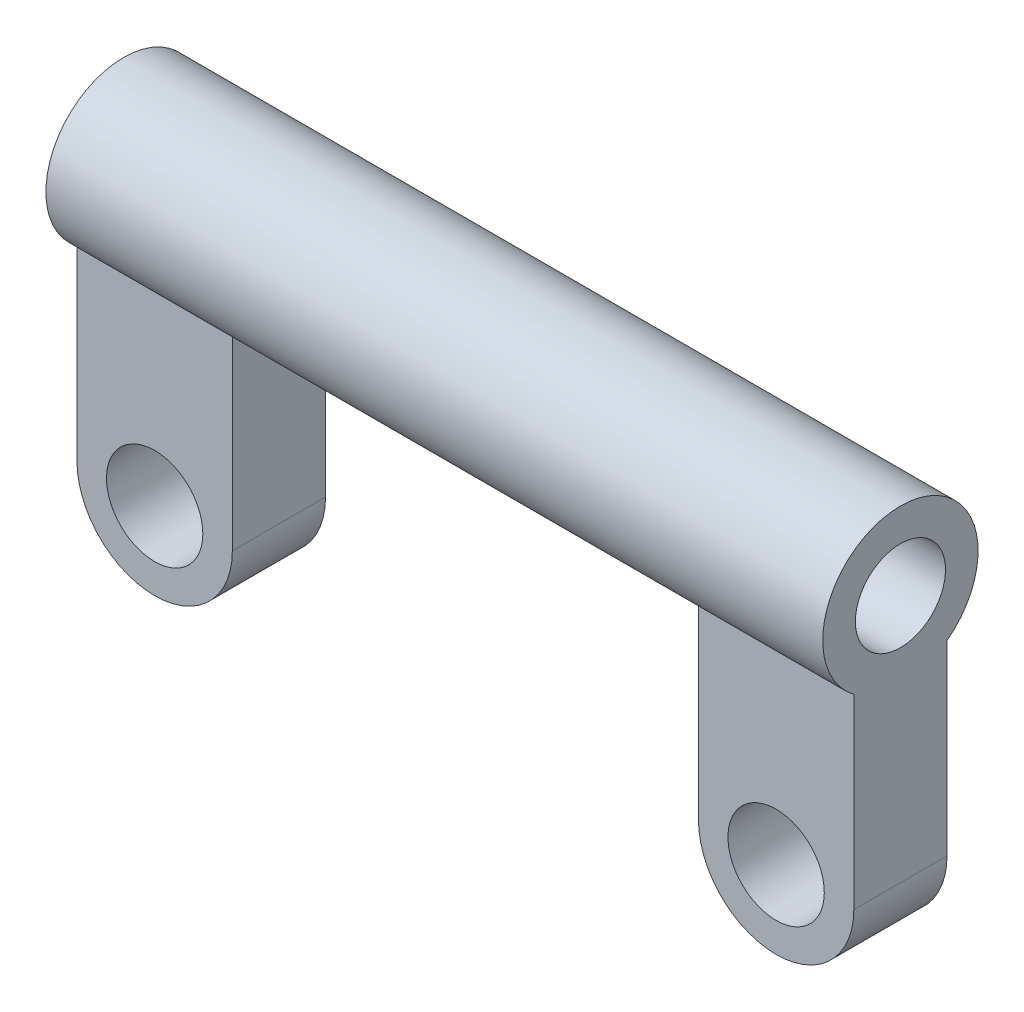
from build123d import *

# Parameters (mm, degrees)
SKETCH1_R             = 1.5500000000000012
BOSS_EXTRUDE1_DEPTH   = 1.5
SKETCH1_W             = 4.999999999999998
SKETCH1_H             = 10.5
BOSS_EXTRUDE1_2_DEPTH = 1.5
BOSS_EXTRUDE2_REACH   = 28.292
SKETCH2_R             = 2.500000000000001
SKETCH2_R_2           = 1.45
CUT_EXTRUDE1_DEPTH    = 25
FILLET1_R             = 2.5


with BuildPart() as part:
    # Sketch1 → Boss-Extrude1 (new, symmetric)
    with BuildSketch(Plane.XY):
        Polygon((-12.499999999999993, -2.4999999999999996), (-7.499999999999993, -2.5), (-7.499999999999993, 8), (-12.499999999999993, 8), align=None)
        with Locations((-9.999999999999995, 0)):
            Circle(SKETCH1_R, mode=Mode.SUBTRACT)
    extrude(amount=BOSS_EXTRUDE1_DEPTH, both=True)


with BuildPart() as body_2:
    # Sketch1 → Boss-Extrude1 2 (new, symmetric)
    with BuildSketch(Plane.XY):
        with Locations((10.000000000000007, 2.75)):
            Rectangle(SKETCH1_W, SKETCH1_H)
        with Locations((10.000000000000009, 2.45e-15)):
            Circle(SKETCH1_R, mode=Mode.SUBTRACT)
    extrude(amount=BOSS_EXTRUDE1_2_DEPTH, both=True)

    # Boss-Extrude2: up to this face of the body (flat: up to its plane)
    boss_extrude2_end = Plane(body_2.part.faces().sort_by_distance((12.5, 2.75, 0))[0])
    # Sketch2 → Boss-Extrude2 (add, up to the picked face)
    with BuildSketch(Plane.ZY.offset(12.499999999999993), mode=Mode.PRIVATE) as boss_extrude2_sk1:
        with Locations(Location((0, 8, 0), (0, 0, 306.869897646))):
            Circle(SKETCH2_R)
        with Locations((0, 8)):
            Circle(SKETCH2_R_2, mode=Mode.SUBTRACT)
    boss_extrude2_tool1 = split(extrude(boss_extrude2_sk1.sketch, amount=-BOSS_EXTRUDE2_REACH, mode=Mode.PRIVATE), bisect_by=boss_extrude2_end, keep=Keep.BOTH, mode=Mode.PRIVATE)

    add(part.part)  # Boss-Extrude2 merges part
    add(boss_extrude2_tool1.solids().sort_by(Axis((-12.5, 9.943431, -1.457574), (1, 0, 0)))[0])

    # Sketch2<2> → Cut-Extrude1 (cut)
    with BuildSketch(Plane.ZY.offset(12.499999999999993)):
        with BuildLine():
            Line((-1.4500000000000002, 8), (1.45, 8))
            ThreePointArc((1.45, 8), (9e-17, 9.45), (-1.45, 8))
        make_face()
        with BuildLine():
            ThreePointArc((-1.45, 8), (-2.7e-16, 6.55), (1.45, 8))
            Line((1.45, 8), (-1.4500000000000002, 8))
        make_face()
    extrude(amount=-CUT_EXTRUDE1_DEPTH, mode=Mode.SUBTRACT)

    # Fillet1
    fillet1_edges = [body_2.edges().sort_by_distance(p)[0] for p in [
        (7.500000000000007, -2.5, 0),
        (-7.499999999999993, -2.5, 0),
        (-12.499999999999993, -2.4999999999999996, 0),
        (12.500000000000007, -2.5, 0),
    ]]
    fillet(fillet1_edges, radius=FILLET1_R - 0.0001)  # a hair under: the kernel refuses the full size


solid = body_2.part
